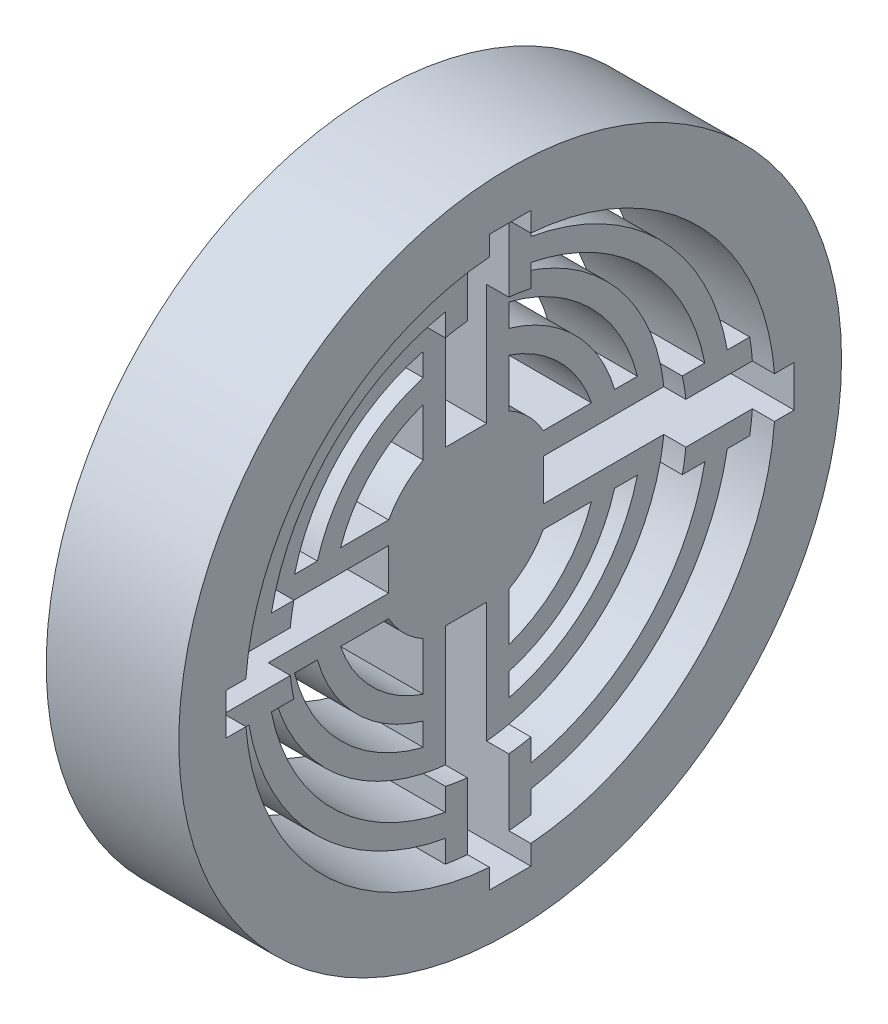
from build123d import *

# Parameters (mm, degrees)
SKETCH1_R           = 7.5
SKETCH1_W           = 0.935836939
SKETCH1_H           = 4.677443156
SKETCH1_W_2         = 4.677419546
SKETCH1_H_2         = 0.93583693
BOSS_EXTRUDE1_DEPTH = 3
CUT_EXTRUDE1_START  = -0.5
SKETCH2_R           = 6
CUT_EXTRUDE1_DEPTH  = 0.5
CUT_EXTRUDE2_START  = -0.5
SKETCH3_R           = 4.5
CUT_EXTRUDE2_DEPTH  = 0.5


with BuildPart() as part:
    # Sketch1 → Boss-Extrude1 (new body)
    with BuildSketch(Plane(origin=(0, 0, 0), x_dir=(0, 0, -1), z_dir=(1, 0, 0))):
        Circle(SKETCH1_R)
        with BuildLine():
            Line((-0.967918465, 2.839565785), (-0.967918465, 1.750181089))
            ThreePointArc((-0.967918465, 1.750181089), (-1.414213562, 1.414213562), (-1.750181089, 0.967918465))
            Line((-1.750181089, 0.967918465), (-2.839565785, 0.967918465))
            ThreePointArc((-2.839565785, 0.967918465), (-2.121320344, 2.121320344), (-0.967918465, 2.839565785))
        make_face(mode=Mode.SUBTRACT)
        with BuildLine():
            Line((-0.967918465, 3.881125332), (-0.967918465, 3.363500237))
            ThreePointArc((-0.967918465, 3.363500237), (-2.474873734, 2.474873734), (-3.363500237, 0.967918465))
            Line((-3.363500237, 0.967918465), (-3.881125332, 0.967918465))
            ThreePointArc((-3.881125332, 0.967918465), (-2.828427125, 2.828427125), (-0.967918465, 3.881125332))
        make_face(mode=Mode.SUBTRACT)
        with BuildLine():
            Line((-0.967918465, 4.905418825), (-0.967918465, 4.394671074))
            ThreePointArc((-0.967918465, 4.394671074), (-3.181980515, 3.181980515), (-4.394671074, 0.967918465))
            Line((-4.394671074, 0.967918465), (-4.905418825, 0.967918465))
            ThreePointArc((-4.905418825, 0.967918465), (-3.535533906, 3.535533906), (-0.967918465, 4.905418825))
        make_face(mode=Mode.SUBTRACT)
        with BuildLine():
            Line((-0.967918465, 5.921413163), (-0.967918465, 5.414160493))
            ThreePointArc((-0.967918465, 5.414160493), (-3.889087297, 3.889087297), (-5.414160493, 0.967918465))
            Line((-5.414160493, 0.967918465), (-5.921413163, 0.967918465))
            ThreePointArc((-5.921413163, 0.967918465), (-4.242640687, 4.242640687), (-0.967918465, 5.921413163))
        make_face(mode=Mode.SUBTRACT)
        with Locations((-5e-09, 4.088902667)):
            Rectangle(SKETCH1_W, SKETCH1_H, mode=Mode.SUBTRACT)
        with Locations((-4.088890862, 0)):
            Rectangle(SKETCH1_W_2, SKETCH1_H_2, mode=Mode.SUBTRACT)
        with Locations((-5e-09, -4.088902667)):
            Rectangle(SKETCH1_W, SKETCH1_H, mode=Mode.SUBTRACT)
        with Locations((4.088890862, 0)):
            Rectangle(SKETCH1_W_2, SKETCH1_H_2, mode=Mode.SUBTRACT)
        with BuildLine():
            ThreePointArc((1.750181089, 0.967918465), (1.414213562, 1.414213562), (0.967918465, 1.750181089))
            Line((0.967918465, 1.750181089), (0.967918465, 2.839565785))
            ThreePointArc((0.967918465, 2.839565785), (2.121320344, 2.121320344), (2.839565785, 0.967918465))
            Line((2.839565785, 0.967918465), (1.750181089, 0.967918465))
        make_face(mode=Mode.SUBTRACT)
        with BuildLine():
            ThreePointArc((0.967918465, -1.750181089), (1.414213562, -1.414213562), (1.750181089, -0.967918465))
            Line((1.750181089, -0.967918465), (2.839565785, -0.967918465))
            ThreePointArc((2.839565785, -0.967918465), (2.121320344, -2.121320344), (0.967918465, -2.839565785))
            Line((0.967918465, -2.839565785), (0.967918465, -1.750181089))
        make_face(mode=Mode.SUBTRACT)
        with BuildLine():
            ThreePointArc((-1.750181089, -0.967918465), (-1.414213562, -1.414213562), (-0.967918465, -1.750181089))
            Line((-0.967918465, -1.750181089), (-0.967918465, -2.839565785))
            ThreePointArc((-0.967918465, -2.839565785), (-2.121320344, -2.121320344), (-2.839565785, -0.967918465))
            Line((-2.839565785, -0.967918465), (-1.750181089, -0.967918465))
        make_face(mode=Mode.SUBTRACT)
        with BuildLine():
            Line((0.967918465, 5.414160493), (0.967918465, 5.921413163))
            ThreePointArc((0.967918465, 5.921413163), (4.242640687, 4.242640687), (5.921413163, 0.967918465))
            Line((5.921413163, 0.967918465), (5.414160493, 0.967918465))
            ThreePointArc((5.414160493, 0.967918465), (3.889087297, 3.889087297), (0.967918465, 5.414160493))
        make_face(mode=Mode.SUBTRACT)
        with BuildLine():
            Line((0.967918465, 4.394671074), (0.967918465, 4.905418825))
            ThreePointArc((0.967918465, 4.905418825), (3.535533906, 3.535533906), (4.905418825, 0.967918465))
            Line((4.905418825, 0.967918465), (4.394671074, 0.967918465))
            ThreePointArc((4.394671074, 0.967918465), (3.181980515, 3.181980515), (0.967918465, 4.394671074))
        make_face(mode=Mode.SUBTRACT)
        with BuildLine():
            Line((0.967918465, 3.363500237), (0.967918465, 3.881125332))
            ThreePointArc((0.967918465, 3.881125332), (2.828427125, 2.828427125), (3.881125332, 0.967918465))
            Line((3.881125332, 0.967918465), (3.363500237, 0.967918465))
            ThreePointArc((3.363500237, 0.967918465), (2.474873734, 2.474873734), (0.967918465, 3.363500237))
        make_face(mode=Mode.SUBTRACT)
        with BuildLine():
            Line((-3.881125332, -0.967918465), (-3.363500237, -0.967918465))
            ThreePointArc((-3.363500237, -0.967918465), (-2.474873734, -2.474873734), (-0.967918465, -3.363500237))
            Line((-0.967918465, -3.363500237), (-0.967918465, -3.881125332))
            ThreePointArc((-0.967918465, -3.881125332), (-2.828427125, -2.828427125), (-3.881125332, -0.967918465))
        make_face(mode=Mode.SUBTRACT)
        with BuildLine():
            Line((-4.905418825, -0.967918465), (-4.394671074, -0.967918465))
            ThreePointArc((-4.394671074, -0.967918465), (-3.181980515, -3.181980515), (-0.967918465, -4.394671074))
            Line((-0.967918465, -4.394671074), (-0.967918465, -4.905418825))
            ThreePointArc((-0.967918465, -4.905418825), (-3.535533906, -3.535533906), (-4.905418825, -0.967918465))
        make_face(mode=Mode.SUBTRACT)
        with BuildLine():
            Line((-5.921413163, -0.967918465), (-5.414160493, -0.967918465))
            ThreePointArc((-5.414160493, -0.967918465), (-3.889087297, -3.889087297), (-0.967918465, -5.414160493))
            Line((-0.967918465, -5.414160493), (-0.967918465, -5.921413163))
            ThreePointArc((-0.967918465, -5.921413163), (-4.242640687, -4.242640687), (-5.921413163, -0.967918465))
        make_face(mode=Mode.SUBTRACT)
        with BuildLine():
            Line((0.967918465, -3.881125332), (0.967918465, -3.363500237))
            ThreePointArc((0.967918465, -3.363500237), (2.474873734, -2.474873734), (3.363500237, -0.967918465))
            Line((3.363500237, -0.967918465), (3.881125332, -0.967918465))
            ThreePointArc((3.881125332, -0.967918465), (2.828427125, -2.828427125), (0.967918465, -3.881125332))
        make_face(mode=Mode.SUBTRACT)
        with BuildLine():
            Line((0.967918465, -4.905418825), (0.967918465, -4.394671074))
            ThreePointArc((0.967918465, -4.394671074), (3.181980515, -3.181980515), (4.394671074, -0.967918465))
            Line((4.394671074, -0.967918465), (4.905418825, -0.967918465))
            ThreePointArc((4.905418825, -0.967918465), (3.535533906, -3.535533906), (0.967918465, -4.905418825))
        make_face(mode=Mode.SUBTRACT)
        with BuildLine():
            Line((0.967918465, -5.921413163), (0.967918465, -5.414160493))
            ThreePointArc((0.967918465, -5.414160493), (3.889087297, -3.889087297), (5.414160493, -0.967918465))
            Line((5.414160493, -0.967918465), (5.921413163, -0.967918465))
            ThreePointArc((5.921413163, -0.967918465), (4.242640687, -4.242640687), (0.967918465, -5.921413163))
        make_face(mode=Mode.SUBTRACT)
    extrude(amount=BOSS_EXTRUDE1_DEPTH)

    # Sketch2 → Cut-Extrude1 (cut)
    with BuildSketch(Plane(origin=(3, 0, 0), x_dir=(0, 0, -1), z_dir=(1, 0, 0)).offset(CUT_EXTRUDE1_START)):
        Circle(SKETCH2_R)
    extrude(amount=CUT_EXTRUDE1_DEPTH, mode=Mode.SUBTRACT)

    # Sketch3 → Cut-Extrude2 (cut)
    with BuildSketch(Plane(origin=(2.5, 0, 0), x_dir=(0, 0, -1), z_dir=(1, 0, 0)).offset(CUT_EXTRUDE2_START)):
        Circle(SKETCH3_R)
    extrude(amount=CUT_EXTRUDE2_DEPTH, mode=Mode.SUBTRACT)


solid = part.part
